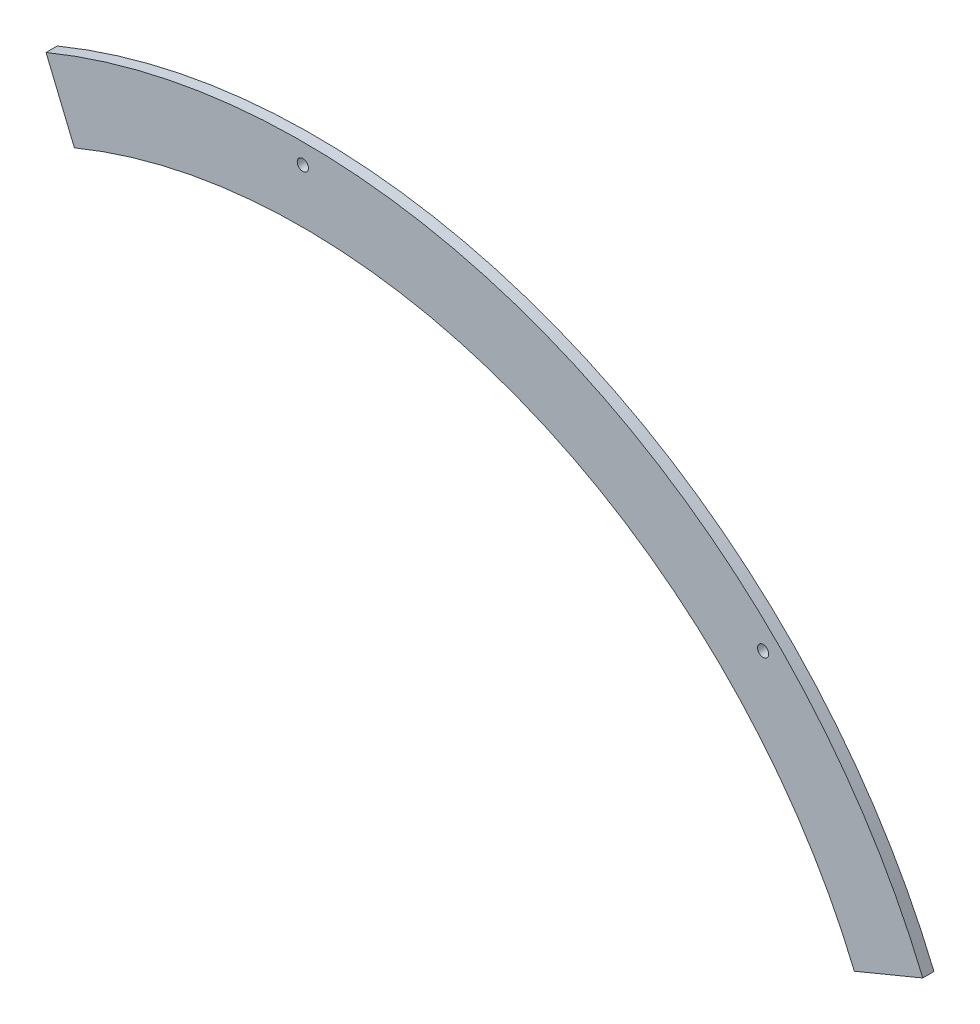
from build123d import *

# Parameters (mm, degrees)
SKETCH2_R           = 190.5
SKETCH2_R_2         = 169.4688
BOSS_EXTRUDE2_DEPTH = 3.175
SKETCH6_R           = 1.5875
CUT_EXTRUDE1_DEPTH  = 270.426391849
SPLIT3_OUTLINE_R    = 1.5875
SPLIT3_DEPTH        = 3.175


# Read off the part's stored shape, not the designer's step: Split3
with BuildPart() as part:
    # Sketch2 → Boss-Extrude2 (new body)
    with BuildSketch(Plane.XY):
        Circle(SKETCH2_R)
        Circle(SKETCH2_R_2, mode=Mode.SUBTRACT)
    extrude(amount=BOSS_EXTRUDE2_DEPTH)

    # Sketch6 → Cut-Extrude1 (cut, through all)
    with BuildSketch(Plane.XY.offset(3.175)):
        with Locations((0, 184.785)):
            Circle(SKETCH6_R)
        with Locations((130.662726562, 130.662726562)):
            Circle(SKETCH6_R)
        with Locations((184.785, 0)):
            Circle(SKETCH6_R)
        with Locations((130.662726562, -130.662726562)):
            Circle(SKETCH6_R)
        with Locations((0, -184.785)):
            Circle(SKETCH6_R)
        with Locations((-130.662726562, -130.662726562)):
            Circle(SKETCH6_R)
        with Locations((-184.785, 0)):
            Circle(SKETCH6_R)
        with Locations((-130.662726562, 130.662726562)):
            Circle(SKETCH6_R)
    extrude(amount=-CUT_EXTRUDE1_DEPTH, mode=Mode.SUBTRACT)

    # Split3 outline → Split3 (cut)
    with BuildSketch(Plane.XY):
        with BuildLine():
            ThreePointArc((-72.901193866, 175.999050943), (-72.901193865, -175.999050944), (175.999050943, 72.901193866))
            Line((175.999050943, 72.901193866), (156.568755719, 64.852902063))
            ThreePointArc((156.568755719, 64.852902063), (-64.852902063, -156.568755719), (-64.852902063, 156.568755719))
            Line((-64.852902063, 156.568755719), (-72.901193866, 175.999050943))
        make_face()
        with Locations((-130.662726562, -130.662726562)):
            Circle(SPLIT3_OUTLINE_R, mode=Mode.SUBTRACT)
        with Locations((0, -184.785)):
            Circle(SPLIT3_OUTLINE_R, mode=Mode.SUBTRACT)
        with Locations((130.662726562, -130.662726562)):
            Circle(SPLIT3_OUTLINE_R, mode=Mode.SUBTRACT)
        with Locations((-184.785, 0)):
            Circle(SPLIT3_OUTLINE_R, mode=Mode.SUBTRACT)
        with Locations((-130.662726562, 130.662726562)):
            Circle(SPLIT3_OUTLINE_R, mode=Mode.SUBTRACT)
        with Locations((184.785, 0)):
            Circle(SPLIT3_OUTLINE_R, mode=Mode.SUBTRACT)
    extrude(amount=SPLIT3_DEPTH, mode=Mode.SUBTRACT)


solid = part.part
